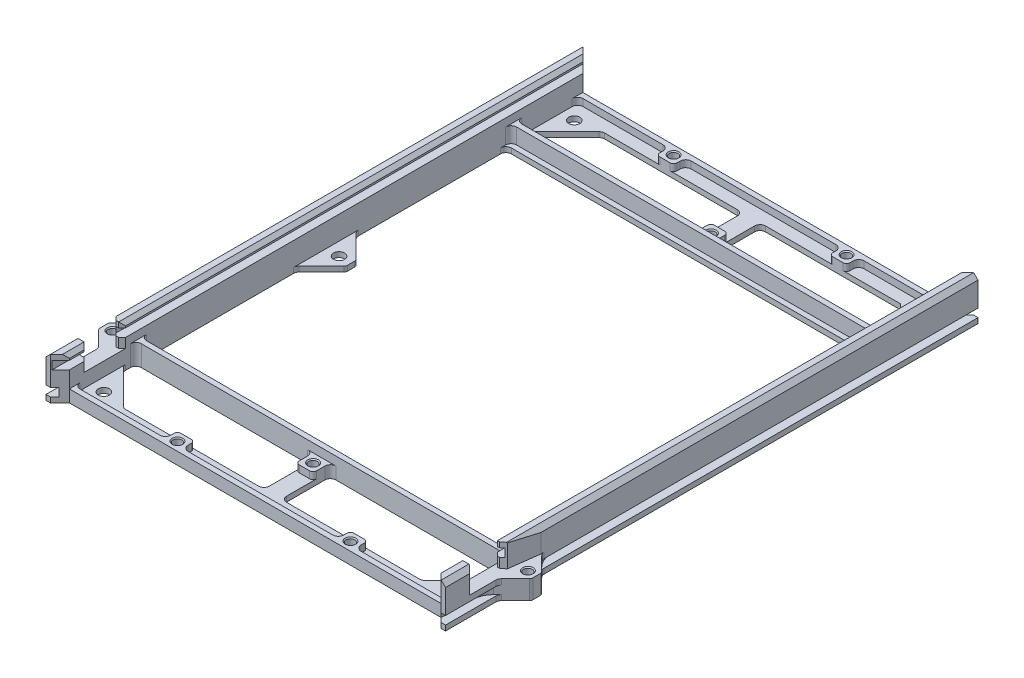
from build123d import *

# Parameters (mm, degrees)
BOSS_EXTRUDE1_DEPTH             = 200
CUT_EXTRUDE1_DEPTH              = 209.524511376
CUT_EXTRUDE1_DEPTH_BACK         = 209.524511376
CUT_EXTRUDE13_DEPTH             = 198.955881199
CUT_EXTRUDE13_DEPTH_BACK        = 198.955881199
SKETCH4_W                       = 107.5
SKETCH4_H                       = 40
SKETCH4_H_2                     = 104
CUT_EXTRUDE14_DEPTH             = 192.019187135
CUT_EXTRUDE14_DEPTH_BACK        = 192.019187135
BOSS_EXTRUDE2_DEPTH             = 1.5
SKETCH14_W                      = 5
SKETCH14_H                      = 5
BOSS_EXTRUDE3_DEPTH             = 3.5
SKETCH16_W                      = 107.5
SKETCH16_H                      = 1.5
CUT_EXTRUDE17_DEPTH             = 4.5
BOSS_EXTRUDE4_DEPTH             = 1.5
SKETCH18_R                      = 1.6
CUT_EXTRUDE19_DEPTH             = 187.549327079
SKETCH19_W                      = 107.5
SKETCH19_H                      = 1.5
BOSS_EXTRUDE5_DEPTH             = 3.5
SKETCH20_R                      = 1.25
BOSS_EXTRUDE6_DEPTH             = 5.5
CUT_EXTRUDE21_REACH             = 190.092
CHAMFER1_SIZE                   = 1
CHAMFER1_SIZE_2                 = 1.160401884
SKETCH24_R                      = 1.25
CUT_EXTRUDE22_DEPTH             = 188.898768097
FILLET6_R                       = 1.5875
FILLET7_R                       = 1.5875
FILLET8_R                       = 1.5875
FILLET9_R                       = 6.35
FILLET10_R                      = 1.5875
FILLET11_R                      = 1.5875
CHAMFER2_SIZE                   = 1
FILLET12_R                      = 1
M3X0_5_TAPPED_HOLE1_D           = 2.5
M3X0_5_TAPPED_HOLE1_CSINK_D     = 3.05
M3X0_5_TAPPED_HOLE1_CSINK_ANGLE = 90
M3X0_5_TAPPED_HOLE2_D           = 2.5
M3X0_5_TAPPED_HOLE2_CSINK_D     = 3.05
M3X0_5_TAPPED_HOLE2_CSINK_ANGLE = 90
CHAMFER3_SIZE                   = 1
FILLET13_R                      = 1


with BuildPart() as part:
    # Sketch1 → Boss-Extrude1 (new body)
    with BuildSketch(Plane.XY):
        Polygon((-53.75, 18.641225), (-53.75, 20.141225), (-56.5, 20.141225), (-57.75, 18.891225), (-57.75, 11.88125), (-55.25, 11.88125), (-55.25, 9.5), (-57.75, 9.5), (-57.75, 8), (57.75, 8), (57.75, 9.5), (55.25, 9.5), (55.25, 11.88125), (57.75, 11.88125), (57.75, 18.891225), (56.5, 20.141225), (53.75, 20.141225), (53.75, 18.641225), (56.25, 18.641225), (56.25, 16.259975), (53.75, 16.259975), (53.75, 14), (-53.75, 14), (-53.75, 16.259975), (-56.25, 16.259975), (-56.25, 18.641225), align=None)
    extrude(amount=-BOSS_EXTRUDE1_DEPTH)

    # Sketch3 → Cut-Extrude1 (cut, two sides: drawn at the far end of the back side and taken through both)
    with BuildSketch(Plane(origin=(0, 20.141225, 0), x_dir=(1, 0, 0), z_dir=(0, 1, 0)).offset(-CUT_EXTRUDE1_DEPTH_BACK)):
        Polygon((-70, 210.41480256), (70, 210.41480256), (70, 162.558185345), (47.31520285, 189.245221226), (35.509970059, 189.245221226), (12.999369656, 170.110522035), (-12.999369656, 170.110522035), (-35.509970059, 189.245221226), (-47.31520285, 189.245221226), (-70, 162.558185345), align=None)
        Polygon((35.509970059, 10.754778774), (47.31520285, 10.754778774), (70, 37.441814655), (70, -10.41480256), (-70, -10.41480256), (-70, 37.441814655), (-47.31520285, 10.754778774), (-35.509970059, 10.754778774), (-12.999369656, 29.889477965), (12.999369656, 29.889477965), align=None)
    extrude(amount=CUT_EXTRUDE1_DEPTH + CUT_EXTRUDE1_DEPTH_BACK, mode=Mode.SUBTRACT)

    # Sketch4 → Cut-Extrude13 (cut, two sides: drawn at the far end of the back side and taken through both)
    with BuildSketch(Plane(origin=(0, 14, 0), x_dir=(1, 0, 0), z_dir=(0, 1, 0)).offset(-CUT_EXTRUDE13_DEPTH_BACK)):
        with Locations((0, 175)):
            Rectangle(SKETCH4_W, SKETCH4_H)
        with Locations((0, 25)):
            Rectangle(SKETCH4_W, SKETCH4_H)
        with Locations((0, 100)):
            Rectangle(SKETCH4_W, SKETCH4_H_2)
    extrude(amount=CUT_EXTRUDE13_DEPTH + CUT_EXTRUDE13_DEPTH_BACK, mode=Mode.SUBTRACT)

    # Sketch12 → Cut-Extrude14 (cut, two sides: drawn at the far end of the back side and taken through both)
    with BuildSketch(Plane(origin=(0, 20.141225, 0), x_dir=(1, 0, 0), z_dir=(0, 1, 0)).offset(-CUT_EXTRUDE14_DEPTH_BACK)):
        Polygon((-57.75, 176.969431228), (-56.5, 176.969431228), (-53.75, 174.219431228), (-53.75, 181.67514417), align=None)
        Polygon((57.75, 176.969431228), (56.5, 176.969431228), (53.75, 174.219431228), (53.75, 181.67514417), align=None)
        Polygon((53.75, 18.32485583), (57.75, 23.030568772), (56.5, 23.030568772), (53.75, 25.780568772), align=None)
        Polygon((-53.75, 18.32485583), (-57.75, 23.030568772), (-56.5, 23.030568772), (-53.75, 25.780568772), align=None)
    extrude(amount=CUT_EXTRUDE14_DEPTH + CUT_EXTRUDE14_DEPTH_BACK, mode=Mode.SUBTRACT)

    # Sketch13 → Boss-Extrude2 (add)
    with BuildSketch(Plane.XZ.offset(-8)):
        Polygon((-53.75, -25.780568772), (53.75, -25.780568772), (53.75, -30.780568772), (2.5, -30.780568772), (2.5, -45), (-2.5, -45), (-2.5, -30.780568772), (-53.75, -30.780568772), align=None)
        Polygon((53.75, -169.219431228), (2.5, -169.219431228), (2.5, -155), (-2.5, -155), (-2.5, -169.219431228), (-53.75, -169.219431228), (-53.75, -174.219431228), (53.75, -174.219431228), align=None)
    extrude(amount=-BOSS_EXTRUDE2_DEPTH)

    # Sketch14 → Boss-Extrude3 (add)
    with BuildSketch(Plane.XZ.offset(-8)):
        with Locations((-25, -28.280568772)):
            Rectangle(SKETCH14_W, SKETCH14_H)
        with Locations((25, -28.280568772)):
            Rectangle(SKETCH14_W, SKETCH14_H)
        with Locations((0, -42.5)):
            Rectangle(SKETCH14_W, SKETCH14_H)
        with Locations((0, -157.5)):
            Rectangle(SKETCH14_W, SKETCH14_H)
        with Locations((25, -171.719431228)):
            Rectangle(SKETCH14_W, SKETCH14_H)
        with Locations((-25, -171.719431228)):
            Rectangle(SKETCH14_W, SKETCH14_H)
    extrude(amount=-BOSS_EXTRUDE3_DEPTH)

    # Sketch16 → Cut-Extrude17 (cut)
    with BuildSketch(Plane(origin=(0, 14, 0), x_dir=(1, 0, 0), z_dir=(0, 1, 0))):
        with Locations((0, 47.25)):
            Rectangle(SKETCH16_W, SKETCH16_H)
        with Locations((0, 152.75)):
            Rectangle(SKETCH16_W, SKETCH16_H)
    extrude(amount=-CUT_EXTRUDE17_DEPTH, mode=Mode.SUBTRACT)

    # Sketch17 → Boss-Extrude4 (add)
    with BuildSketch(Plane.XZ.offset(-8)):
        Polygon((43.123714522, -169.219431228), (53.75, -158.593145751), (53.75, -169.219431228), align=None)
        Polygon((-53.75, -169.219431228), (-43.123714522, -169.219431228), (-53.75, -158.593145751), align=None)
        Polygon((-53.75, -41.406854249), (-53.75, -30.780568772), (-43.123714522, -30.780568772), align=None)
        Polygon((53.75, -30.780568772), (43.123714522, -30.780568772), (53.75, -41.406854249), align=None)
        Polygon((-46.5, -101.449747468), (-46.5, -98.550252532), (-53.75, -91.300252532), (-53.75, -108.699747468), align=None)
        Polygon((46.5, -101.449747468), (46.5, -98.550252532), (53.75, -91.300252532), (53.75, -108.699747468), align=None)
    extrude(amount=-BOSS_EXTRUDE4_DEPTH)

    # Sketch18 → Cut-Extrude19 (cut, through all)
    with BuildSketch(Plane.XZ.offset(-8)):
        with Locations(Location((50, -168, 0), (0, 0, 270))):
            Circle(SKETCH18_R)
        with Locations(Location((50, -100, 0), (0, 0, 270))):
            Circle(SKETCH18_R)
        with Locations(Location((50, -32, 0), (0, 0, 270))):
            Circle(SKETCH18_R)
        with Locations(Location((-50, -32, 0), (0, 0, 270))):
            Circle(SKETCH18_R)
        with Locations(Location((-50, -100, 0), (0, 0, 270))):
            Circle(SKETCH18_R)
        with Locations(Location((-50, -168, 0), (0, 0, 270))):
            Circle(SKETCH18_R)
    extrude(amount=-CUT_EXTRUDE19_DEPTH, mode=Mode.SUBTRACT)

    # Sketch19 → Boss-Extrude5 (add)
    with BuildSketch(Plane.XZ.offset(-8)):
        with Locations((0, -26.530568772)):
            Rectangle(SKETCH19_W, SKETCH19_H)
        with Locations((0, -173.469431228)):
            Rectangle(SKETCH19_W, SKETCH19_H)
    extrude(amount=-BOSS_EXTRUDE5_DEPTH)

    # Sketch20 → Boss-Extrude6 (add)
    # profile 1 of 2: a face of its own
    with BuildSketch(Plane.XZ.offset(-8)):
        Polygon((62.55474957, -43.044510378), (62.55474957, -46.044510378), (55.25, -53.349259948), (55.25, -35.739760808), align=None)
        with Locations(Location((60.05474957, -44.544510378, 0), (0, 0, 270))):
            Circle(SKETCH20_R, mode=Mode.SUBTRACT)
    # profile 2 of 2: a face of its own
    with BuildSketch(Plane.XZ.offset(-8)):
        Polygon((-62.55474957, -43.044510378), (-55.25, -35.739760808), (-55.25, -53.349259948), (-62.55474957, -46.044510378), align=None)
        with Locations(Location((-60.05474957, -44.544510378, 0), (0, 0, 90))):
            Circle(SKETCH20_R, mode=Mode.SUBTRACT)
    extrude(amount=-BOSS_EXTRUDE6_DEPTH)

    # Cut-Extrude21: up to this face of the body (flat: up to its plane)
    cut_extrude21_end = Plane(part.part.faces().sort_by_distance((60.056958568, 13.5, -40.73755181))[0])
    # Sketch22 → Cut-Extrude21 (cut, up to the picked face)
    with BuildSketch(Plane(origin=(0, 20.141225, 0), x_dir=(1, 0, 0), z_dir=(0, 1, 0)), mode=Mode.PRIVATE) as cut_extrude21_sk1:
        Polygon((57.75, 31.030568772), (53.75, 31.030568772), (53.75, 41.030568772), (56.5, 41.030568772), (57.75, 50.581298561), align=None)
    cut_extrude21_tool1 = split(extrude(cut_extrude21_sk1.sketch, amount=-CUT_EXTRUDE21_REACH, mode=Mode.PRIVATE), bisect_by=cut_extrude21_end, keep=Keep.BOTH, mode=Mode.PRIVATE)
    # Sketch22 → Cut-Extrude21 (cut, up to the picked face)
    with BuildSketch(Plane(origin=(0, 20.141225, 0), x_dir=(1, 0, 0), z_dir=(0, 1, 0)), mode=Mode.PRIVATE) as cut_extrude21_sk2:
        Polygon((-53.75, 41.030568772), (-56.5, 41.030568772), (-57.75, 50.581298561), (-57.75, 31.030568772), (-53.75, 31.030568772), align=None)
    cut_extrude21_tool2 = split(extrude(cut_extrude21_sk2.sketch, amount=-CUT_EXTRUDE21_REACH, mode=Mode.PRIVATE), bisect_by=cut_extrude21_end, keep=Keep.BOTH, mode=Mode.PRIVATE)
    add(cut_extrude21_tool1.solids().sort_by(Axis((55.955599, 20.141225, -37.093225), (0, -1, 0)))[0], mode=Mode.SUBTRACT)
    add(cut_extrude21_tool2.solids().sort_by(Axis((-55.955599, 20.141225, -37.093225), (0, -1, 0)))[0], mode=Mode.SUBTRACT)

    # Chamfer1
    # the kernel refuses this chamfer: 1.160401884, 1 mm, written as the material it takes off along each edge
    with BuildSketch(Plane(origin=(-53.75, 22.712907988, -31.030568772), x_dir=(0.0274958766105891, 0, 0.9996219169112968), z_dir=(0, -1, 0)), Plane(origin=(-53.75, 22.712907988, -41.030568772), x_dir=(-0.9996219169112968, 0, 0.027495876610589005), z_dir=(0, -1, 0)), Plane(origin=(53.75, 22.712907988, -41.030568772), x_dir=(-0.027495876610589005, 0, -0.9996219169112968), z_dir=(0, -1, 0))) as chamfer1_piece_1:
        Polygon((CHAMFER1_SIZE * 0.999621916911, CHAMFER1_SIZE * 0.0274958766106), (-CHAMFER1_SIZE * 0.0274958766106, CHAMFER1_SIZE * 0.999621916911), (0, 0), align=None)
    extrude(amount=6.643365976, mode=Mode.SUBTRACT)
    with BuildSketch(Plane(origin=(-53.75, 18.831657988, -31.030568772), x_dir=(-0.9996219169112968, 0, -0.02749587661058555), z_dir=(0, -1, 0)), Plane(origin=(-53.75, 18.831657988, -41.030568772), x_dir=(0.027495876610589005, 0, -0.9996219169112968), z_dir=(0, -1, 0)), Plane(origin=(53.75, 18.831657988, -31.030568772), x_dir=(-0.0274958766105891, 0, 0.9996219169112968), z_dir=(0, -1, 0))) as chamfer1_piece_2:
        Polygon((CHAMFER1_SIZE * 0.999621916911, -CHAMFER1_SIZE * 0.0274958766106), (-CHAMFER1_SIZE * 0.0274958766106, -CHAMFER1_SIZE * 0.999621916911), (0, 0), align=None)
    extrude(amount=5.331657988, mode=Mode.SUBTRACT)
    with BuildSketch(Plane(origin=(-57.75, 21.462907988, -31.030568772), x_dir=(0.9996219169112968, 0, -0.02749587661058555), z_dir=(0, -1, 0)), Plane(origin=(57.75, 21.462907988, -31.030568772), x_dir=(0.0274958766105891, 0, 0.9996219169112968), z_dir=(0, -1, 0))) as chamfer1_piece_3:
        Polygon((CHAMFER1_SIZE * 0.999621916911, CHAMFER1_SIZE * 0.0274958766106), (-CHAMFER1_SIZE * 0.0274958766106, CHAMFER1_SIZE * 0.999621916911), (0, 0), align=None)
    extrude(amount=7.962907988, mode=Mode.SUBTRACT)
    with BuildSketch(Plane(origin=(53.75, 22.712907988, -31.030568772), x_dir=(-0.0274958766105891, 0, 0.9996219169112968), z_dir=(0, -1, 0))) as chamfer1_piece_4:
        Polygon((CHAMFER1_SIZE * 0.999621916911, -CHAMFER1_SIZE * 0.0274958766106), (-CHAMFER1_SIZE * 0.0274958766106, -CHAMFER1_SIZE * 0.999621916911), (0, 0), align=None)
    extrude(amount=6.643365976, mode=Mode.SUBTRACT)
    with BuildSketch(Plane(origin=(53.75, 18.831657988, -41.030568772), x_dir=(-0.027495876610589005, 0, -0.9996219169112968), z_dir=(0, -1, 0))) as chamfer1_piece_5:
        Polygon((CHAMFER1_SIZE * 0.999621916911, CHAMFER1_SIZE * 0.0274958766106), (-CHAMFER1_SIZE * 0.0274958766106, CHAMFER1_SIZE * 0.999621916911), (0, 0), align=None)
    extrude(amount=5.331657988, mode=Mode.SUBTRACT)
    with BuildSketch(Plane(origin=(-56.5, 23.135072076, -41.030568772), x_dir=(0.9994954573969487, 0, 0.03176209443446987), z_dir=(0, -1, 0))) as chamfer1_piece_6:
        Polygon((CHAMFER1_SIZE * 0.999495457397, -CHAMFER1_SIZE * 0.0317620944345), (-CHAMFER1_SIZE_2 * 0.161201317086, -CHAMFER1_SIZE_2 * 0.986921545026), (0, 0), align=None)
    extrude(amount=9.635072076, mode=Mode.SUBTRACT)
    with BuildSketch(Plane(origin=(56.5, 23.135072076, -41.030568772), x_dir=(-0.9997210403675997, 0, 0.023618667327432837), z_dir=(0, -1, 0))) as chamfer1_piece_7:
        Polygon((CHAMFER1_SIZE_2 * 0.9997210407, CHAMFER1_SIZE_2 * 0.0236186673353), (-CHAMFER1_SIZE * 0.153156027896, CHAMFER1_SIZE * 0.988202019386), (0, 0), align=None)
    extrude(amount=9.635072076, mode=Mode.SUBTRACT)

    # Sketch24 → Cut-Extrude22 (cut, through all)
    with BuildSketch(Plane(origin=(0, 11.5, 0), x_dir=(1, 0, 0), z_dir=(0, 1, 0))):
        with Locations(Location((0, 42.5, 0), (0, 0, 270))):
            Circle(SKETCH24_R)
        with Locations(Location((-25, 28.280568772, 0), (0, 0, 270))):
            Circle(SKETCH24_R)
        with Locations(Location((25, 28.280568772, 0), (0, 0, 270))):
            Circle(SKETCH24_R)
        with Locations(Location((25, 171.719431228, 0), (0, 0, 270))):
            Circle(SKETCH24_R)
        with Locations(Location((-25, 171.719431228, 0), (0, 0, 270))):
            Circle(SKETCH24_R)
        with Locations(Location((0, 157.5, 0), (0, 0, 270))):
            Circle(SKETCH24_R)
    extrude(amount=-CUT_EXTRUDE22_DEPTH, mode=Mode.SUBTRACT)

    # Fillet6
    fillet6_edges = [part.edges().sort_by_distance(p)[0] for p in [
        (53.75, 8.75, -152),
        (-53.75, 8.75, -48),
        (-53.75, 8.75, -152),
        (53.75, 8.75, -48),
        (2.5, 8.75, -30.780568772),
        (-2.5, 8.75, -30.780568772),
        (-43.123714522, 8.75, -30.780568772),
        (-53.75, 8.75, -41.406854249),
        (53.75, 8.75, -41.406854249),
        (43.123714522, 8.75, -30.780568772),
        (-53.75, 8.75, -91.300252532),
        (-53.75, 8.75, -108.699747468),
        (53.75, 8.75, -108.699747468),
        (53.75, 8.75, -91.300252532),
    ]]
    fillet(fillet6_edges, radius=FILLET6_R)

    # Fillet7
    fillet7_edges = [part.edges().sort_by_distance(p)[0] for p in [
        (53.75, 11, -155),
        (-53.75, 11, -155),
        (-53.75, 11, -45),
        (53.75, 11, -45),
        (-2.5, 8.75, -169.219431228),
        (2.5, 8.75, -169.219431228),
        (53.75, 11.75, -46.5),
        (-53.75, 11.75, -46.5),
        (-53.75, 11.75, -153.5),
        (53.75, 11.75, -153.5),
        (53.75, 8.75, -158.593145751),
        (-53.75, 8.75, -158.593145751),
        (-43.123714522, 8.75, -169.219431228),
        (53.75, 10.5, -172.719431228),
        (27.5, 10.5, -172.719431228),
        (-27.5, 10.5, -172.719431228),
        (-53.75, 10.5, -172.719431228),
        (22.5, 10.5, -172.719431228),
        (-22.5, 10.5, -172.719431228),
    ]]
    fillet(fillet7_edges, radius=FILLET7_R)

    # Fillet8
    fillet8_edges = [part.edges().sort_by_distance(p)[0] for p in [
        (2.5, 9.75, -45),
        (-2.5, 9.75, -45),
        (-2.5, 9.75, -155),
        (2.5, 9.75, -155),
    ]]
    fillet(fillet8_edges, radius=FILLET8_R)

    # Fillet9
    fillet9_edges = [part.edges().sort_by_distance(p)[0] for p in [
        (55.25, 10.690625, -53.349259948),
        (55.25, 10.690625, -35.739760808),
        (-55.25, 10.690625, -35.739760808),
        (-55.25, 10.690625, -53.349259948),
    ]]
    fillet(fillet9_edges, radius=FILLET9_R)

    # Fillet10
    fillet10_edges = [part.edges().sort_by_distance(p)[0] for p in [
        (57.75, 12.690625, -50.849259948),
        (57.75, 8.75, -50.849259948),
        (57.75, 12.690625, -38.239760808),
        (57.75, 8.75, -38.239760808),
        (-57.75, 12.690625, -50.849259948),
        (-57.75, 12.690625, -38.239760808),
        (-57.75, 8.75, -38.239760808),
        (-57.75, 8.75, -50.849259948),
    ]]
    fillet(fillet10_edges, radius=FILLET10_R)

    # Fillet11
    fillet11_edges = [part.edges().sort_by_distance(p)[0] for p in [
        (-27.5, 10.5, -27.280568772),
        (53.75, 10.5, -27.280568772),
        (27.5, 10.5, -27.280568772),
        (-22.5, 10.5, -27.280568772),
        (22.5, 10.5, -27.280568772),
        (-53.75, 10.5, -27.280568772),
    ]]
    fillet(fillet11_edges, radius=FILLET11_R)

    # Chamfer2
    chamfer2_edges = [part.edges().sort_by_distance(p)[0] for p in [
        (-53.75, 20.141225, -108.125),
        (53.75, 20.141225, -108.125),
    ]]
    chamfer(chamfer2_edges, length=CHAMFER2_SIZE)

    # Fillet12
    fillet12_edges = [part.edges().sort_by_distance(p)[0] for p in [
        (-2.5, 10.5, -40),
        (2.5, 10.5, -40),
        (-22.5, 10.5, -30.780568772),
        (-27.5, 10.5, -30.780568772),
        (2.5, 10.5, -160),
        (-2.5, 10.5, -160),
        (27.5, 10.5, -30.780568772),
        (22.5, 10.5, -30.780568772),
        (27.5, 10.5, -169.219431228),
        (22.5, 10.5, -169.219431228),
        (-27.5, 10.5, -169.219431228),
        (-22.5, 10.5, -169.219431228),
    ]]
    fillet(fillet12_edges, radius=FILLET12_R)

    # M3x0.5 Tapped Hole1 (through all)
    with Locations(Plane(origin=(-60.05474957, 13.5, -44.544510378), x_dir=(0, 0, 1), z_dir=(0, 1, 0))):
        with Locations((0, 0), (0, 120.10949914)):
            CounterSinkHole(M3X0_5_TAPPED_HOLE1_D / 2, M3X0_5_TAPPED_HOLE1_CSINK_D / 2, counter_sink_angle=M3X0_5_TAPPED_HOLE1_CSINK_ANGLE)

    # M3x0.5 Tapped Hole2 (through all)
    with Locations(Plane(origin=(-25, 11.5, -28.280568772), x_dir=(0, 0, 1), z_dir=(0, 1, 0))):
        with Locations((0, 0), (-14.219431228, 25), (0, 50), (-143.438862456, 0), (-129.219431228, 25), (-143.438862456, 50)):
            CounterSinkHole(M3X0_5_TAPPED_HOLE2_D / 2, M3X0_5_TAPPED_HOLE2_CSINK_D / 2, counter_sink_angle=M3X0_5_TAPPED_HOLE2_CSINK_ANGLE)

    # Chamfer3
    chamfer3_edges = [part.edges().sort_by_distance(p)[0] for p in [
        (53.75, 20.141225, -27.905568772),
        (-53.75, 20.141225, -27.905568772),
    ]]
    chamfer(chamfer3_edges, length=CHAMFER3_SIZE)

    # Fillet13
    fillet13_edges = [part.edges().sort_by_distance(p)[0] for p in [
        (-46.5, 8.75, -98.550252532),
        (-46.5, 8.75, -101.449747468),
        (46.5, 8.75, -101.449747468),
        (46.5, 8.75, -98.550252532),
        (62.55474957, 10.75, -46.044510378),
        (62.55474957, 10.75, -43.044510378),
        (-62.55474957, 10.75, -46.044510378),
        (-62.55474957, 10.75, -43.044510378),
    ]]
    fillet(fillet13_edges, radius=FILLET13_R)


solid = part.part
